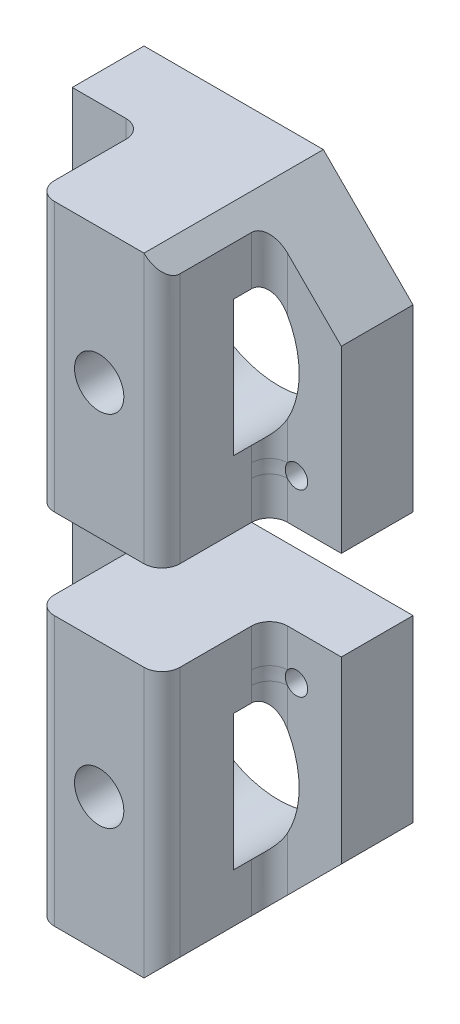
from build123d import *

# Parameters (mm, degrees)
SKETCH1_R          = 1.25
MAIN_DEPTH         = 20
SKETCH2_R          = 10.3
CENTRALHOLE_DEPTH  = 12
SKETCH5_R          = 2.75
SKETCH5_W          = 8
SKETCH5_H          = 30
CUT_EXTRUDE3_DEPTH = 12
FILLET1_R          = 2


with BuildPart() as part:
    # Sketch1 → Main (new body)
    with BuildSketch(Plane.XY):
        Polygon((-15, -15), (5, -15), (15, -5), (15, 15), (-15, 15), align=None)
        with Locations((-10, 10)):
            Circle(SKETCH1_R, mode=Mode.SUBTRACT)
        with Locations((10, 10)):
            Circle(SKETCH1_R, mode=Mode.SUBTRACT)
        with Locations((-10, -10)):
            Circle(SKETCH1_R, mode=Mode.SUBTRACT)
    extrude(amount=MAIN_DEPTH)

    # Sketch2 → CentralHole (cut)
    with BuildSketch(Plane.XY):
        Circle(SKETCH2_R)
    extrude(amount=CENTRALHOLE_DEPTH, mode=Mode.SUBTRACT)

    # Sketch5 → Cut-Extrude3 (cut)
    with BuildSketch(Plane.XY.offset(20)):
        Circle(SKETCH5_R)
        with Locations((11, 0)):
            Rectangle(SKETCH5_W, SKETCH5_H)
        with Locations((-11, 0)):
            Rectangle(SKETCH5_W, SKETCH5_H)
    extrude(amount=-CUT_EXTRUDE3_DEPTH, mode=Mode.SUBTRACT)

    # Fillet1
    fillet1_edges = [part.edges().sort_by_distance(p)[0] for p in [
        (-7, 0, 20),
        (7, 1, 20),
        (-7, -11.27789624, 8),
        (-7, 11.27789624, 8),
        (7, 11.27789624, 8),
        (7, -10.27789624, 8),
    ]]
    fillet(fillet1_edges, radius=FILLET1_R)


with BuildPart() as body_2:
    # Mirror1: mirrored copy
    add(part.part.mirror(Plane.ZX.offset(20)))


solid = Compound([part.part, body_2.part])
